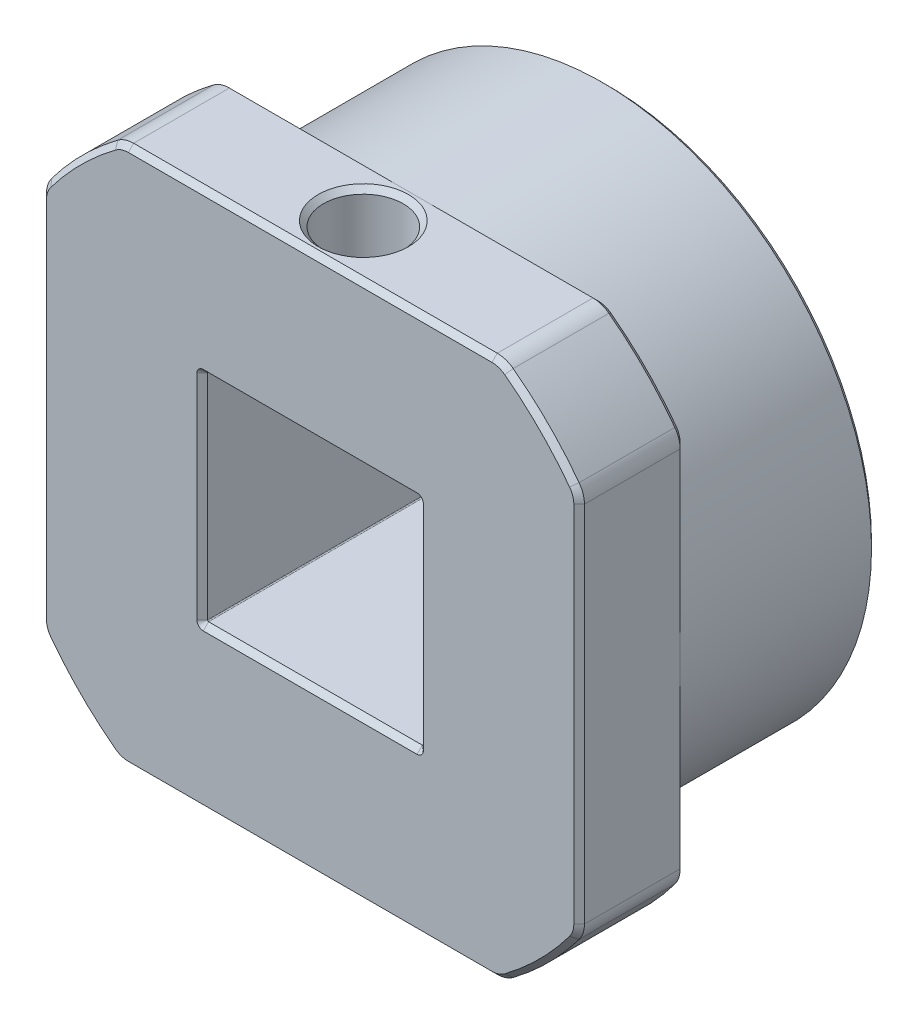
from build123d import *

# Parameters (mm, degrees)
SKIZZE1_R                       = 25.3
SKIZZE1_W                       = 20.3
SKIZZE1_H                       = 20.3
AUFSATZ_LINEAR_AUSTRAGEN1_DEPTH = 18
SKIZZE2_W                       = 20.3
SKIZZE2_H                       = 20.3
AUFSATZ_LINEAR_AUSTRAGEN2_DEPTH = 10
SCHNITT_LINEAR_AUSTRAGEN1_REACH = 65.122
SKIZZE3_R                       = 2.3
CUT_EXTRUDE2_START              = -50.6
SKETCH1_2_R                     = 3.75
CUT_EXTRUDE2_DEPTH              = 7.95
VERRUNDUNG1_R                   = 0.1
VERRUNDUNG2_R                   = 2.5
FASE1_SIZE                      = 0.5


with BuildPart() as part:
    # Skizze1 → Aufsatz-Linear austragen1 (new body)
    with BuildSketch(Plane.XY):
        Circle(SKIZZE1_R)
        Rectangle(SKIZZE1_W, SKIZZE1_H, mode=Mode.SUBTRACT)
    extrude(amount=AUFSATZ_LINEAR_AUSTRAGEN1_DEPTH)

    # Skizze2 → Aufsatz-Linear austragen2 (add)
    with BuildSketch(Plane.XY.offset(18)):
        with BuildLine():
            Line((-17.913961036, 25.3), (17.913961036, 25.3))
            ThreePointArc((17.913961036, 25.3), (21.920310217, 21.920310217), (25.3, 17.913961036))
            Line((25.3, 17.913961036), (25.3, -17.913961036))
            ThreePointArc((25.3, -17.913961036), (21.920310217, -21.920310217), (17.913961036, -25.3))
            Line((17.913961036, -25.3), (-17.913961036, -25.3))
            ThreePointArc((-17.913961036, -25.3), (-21.920310217, -21.920310217), (-25.3, -17.913961036))
            Line((-25.3, -17.913961036), (-25.3, 17.913961036))
            ThreePointArc((-25.3, 17.913961036), (-21.920310217, 21.920310217), (-17.913961036, 25.3))
        make_face()
        Rectangle(SKIZZE2_W, SKIZZE2_H, mode=Mode.SUBTRACT)
    extrude(amount=AUFSATZ_LINEAR_AUSTRAGEN2_DEPTH)

    # Skizze3 → Schnitt-Linear austragen1 (cut, up to next)
    with BuildSketch(Plane(origin=(0, 25.3, 0), x_dir=(1, 0, 0), z_dir=(0, 1, 0)), mode=Mode.PRIVATE) as schnitt_linear_austragen1_sk1:
        with Locations(Location((0, -23, 0), (0, 0, 270))):
            Circle(SKIZZE3_R)
    schnitt_linear_austragen1_tool1 = extrude(schnitt_linear_austragen1_sk1.sketch, amount=-SCHNITT_LINEAR_AUSTRAGEN1_REACH, mode=Mode.PRIVATE) & part.part
    add(schnitt_linear_austragen1_tool1.solids().sort_by_distance((0, 25.3, 23))[0], mode=Mode.SUBTRACT)

    # Sketch1<2> → Cut-Extrude2 (cut)
    with BuildSketch(Plane.XZ.offset(25.3).offset(CUT_EXTRUDE2_START)):
        with Locations(Location((0, 23, 0), (0, 0, 270))):
            Circle(SKETCH1_2_R)
    extrude(amount=CUT_EXTRUDE2_DEPTH, mode=Mode.SUBTRACT)

    # Verrundung1
    verrundung1_edges = [part.edges().sort_by_distance(p)[0] for p in [
        (10.15, -10.15, 14),
        (10.15, 10.15, 14),
        (-10.15, 10.15, 14),
        (-10.15, -10.15, 14),
    ]]
    fillet(verrundung1_edges, radius=VERRUNDUNG1_R)

    # Verrundung2
    verrundung2_edges = [part.edges().sort_by_distance(p)[0] for p in [
        (-17.913961036, 25.3, 23),
        (-25.3, 17.913961036, 23),
        (-25.3, -17.913961036, 23),
        (-17.913961036, -25.3, 23),
        (17.913961036, -25.3, 23),
        (25.3, -17.913961036, 23),
        (25.3, 17.913961036, 23),
        (17.913961036, 25.3, 23),
    ]]
    fillet(verrundung2_edges, radius=VERRUNDUNG2_R)

    # Fase1
    # the kernel refuses this chamfer: 0.5 mm, written as the material it takes off along each edge
    with BuildSketch(Plane(origin=(-22.8, -17.1, 18), x_dir=(-0.8000000000000012, -0.5999999999999983, 0), z_dir=(0.5999999999999983, -0.8000000000000012, 0))) as fase1_piece_1:
        Polygon((2.5, -FASE1_SIZE), (2.5 - FASE1_SIZE, 0), (2.5, 0), align=None)
    revolve(axis=Axis((-22.8, -17.1, 18), (0, 0, -1)), revolution_arc=36.869897646, mode=Mode.SUBTRACT)
    with BuildSketch(Plane(origin=(-25.3, 8.3e-08, 18), x_dir=(-0.027495876610589005, 0, 0.9996219169112968), z_dir=(0, 1, 0))) as fase1_piece_2_section:
        Polygon((FASE1_SIZE * 0.999621916911, FASE1_SIZE * 0.0274958766106), (-FASE1_SIZE * 0.0274958766106, FASE1_SIZE * 0.999621916911), (0, 0), align=None)
    fase1_piece_2 = extrude(amount=17.099999917, mode=Mode.PRIVATE)
    fase1_piece_2 = fase1_piece_2 - Plane(origin=(0, 0, 18.17274178), x_dir=(1, 0, 0), z_dir=(0, 0, -1)) * Cylinder(25.3, 37, mode=Mode.PRIVATE)
    add(fase1_piece_2, mode=Mode.SUBTRACT)
    with BuildSketch(Plane(origin=(-25.3, -17.1, 28), x_dir=(0.9996219169112968, 0, 0.027495876610589005), z_dir=(0, 1, 0)), Plane(origin=(17.1, -25.3, 28), x_dir=(0, 0.9996219169112968, 0.027495876610589005), z_dir=(-1, 0, 0)), Plane(origin=(25.3, 17.1, 28), x_dir=(-0.9996219169112968, 0, 0.027495876610589005), z_dir=(0, -1, 0)), Plane(origin=(-17.1, 25.3, 28), x_dir=(0, -0.9996219169112968, 0.027495876610589005), z_dir=(1, 0, 0))) as fase1_piece_3:
        Polygon((FASE1_SIZE * 0.999621916911, FASE1_SIZE * 0.0274958766106), (-FASE1_SIZE * 0.0274958766106, FASE1_SIZE * 0.999621916911), (0, 0), align=None)
    extrude(amount=34.2, mode=Mode.SUBTRACT)
    with BuildSketch(Plane(origin=(0, 0, 28), x_dir=(-0.8000000000000004, 0.5999999999999995, 0), z_dir=(-0.5999999999999995, -0.8000000000000004, 0))) as fase1_piece_4:
        Polygon((31 - FASE1_SIZE, 0), (31, FASE1_SIZE), (31, 0), align=None)
    revolve(axis=Axis((0, 0, 28), (0, 0, -1)), revolution_arc=16.260204708, mode=Mode.SUBTRACT)
    with BuildSketch(Plane(origin=(0, 0, 28), x_dir=(0.8, -0.5999999999999999, 0), z_dir=(0.5999999999999999, 0.8, 0))) as fase1_piece_5:
        Polygon((31 - FASE1_SIZE, 0), (31, FASE1_SIZE), (31, 0), align=None)
    revolve(axis=Axis((0, 0, 28), (0, 0, -1)), revolution_arc=16.260204708, mode=Mode.SUBTRACT)
    with BuildSketch(Plane(origin=(0, 0, 28), x_dir=(0.5999999999999996, 0.8000000000000003, 0), z_dir=(-0.8000000000000003, 0.5999999999999996, 0))) as fase1_piece_6:
        Polygon((31 - FASE1_SIZE, 0), (31, FASE1_SIZE), (31, 0), align=None)
    revolve(axis=Axis((0, 0, 28), (0, 0, -1)), revolution_arc=16.260204708, mode=Mode.SUBTRACT)
    with BuildSketch(Plane(origin=(-17.1, 22.8, 28), x_dir=(0, 1, 0), z_dir=(1, 0, 0))) as fase1_piece_7:
        Polygon((2.5 - FASE1_SIZE, 0), (2.5, -FASE1_SIZE), (2.5, 0), align=None)
    revolve(axis=Axis((-17.1, 22.8, 28), (0, 0, 1)), revolution_arc=36.869897646, mode=Mode.SUBTRACT)
    with BuildSketch(Plane(origin=(-22.8, 17.1, 28), x_dir=(-1, 0, 0), z_dir=(0, -1, 0))) as fase1_piece_8:
        Polygon((2.5 - FASE1_SIZE, 0), (2.5, FASE1_SIZE), (2.5, 0), align=None)
    revolve(axis=Axis((-22.8, 17.1, 28), (0, 0, -1)), revolution_arc=36.869897646, mode=Mode.SUBTRACT)
    with BuildSketch(Plane(origin=(17.1, 22.8, 28), x_dir=(0, 1, 0), z_dir=(-1, 0, 0))) as fase1_piece_9:
        Polygon((2.5 - FASE1_SIZE, 0), (2.5, FASE1_SIZE), (2.5, 0), align=None)
    revolve(axis=Axis((17.1, 22.8, 28), (0, 0, -1)), revolution_arc=36.869897646, mode=Mode.SUBTRACT)
    with BuildSketch(Plane(origin=(22.8, 17.1, 28), x_dir=(0.8, 0.6, 0), z_dir=(-0.6, 0.8, 0))) as fase1_piece_10:
        Polygon((2.5 - FASE1_SIZE, 0), (2.5, FASE1_SIZE), (2.5, 0), align=None)
    revolve(axis=Axis((22.8, 17.1, 28), (0, 0, -1)), revolution_arc=36.869897646, mode=Mode.SUBTRACT)
    with BuildSketch(Plane(origin=(22.8, -17.1, 28), x_dir=(1, 0, 0), z_dir=(0, 1, 0))) as fase1_piece_11:
        Polygon((2.5 - FASE1_SIZE, 0), (2.5, FASE1_SIZE), (2.5, 0), align=None)
    revolve(axis=Axis((22.8, -17.1, 28), (0, 0, -1)), revolution_arc=36.869897646, mode=Mode.SUBTRACT)
    with BuildSketch(Plane(origin=(17.1, -22.8, 28), x_dir=(0.6000000000000009, -0.7999999999999993, 0), z_dir=(0.7999999999999993, 0.6000000000000009, 0))) as fase1_piece_12:
        Polygon((2.5 - FASE1_SIZE, 0), (2.5, FASE1_SIZE), (2.5, 0), align=None)
    revolve(axis=Axis((17.1, -22.8, 28), (0, 0, -1)), revolution_arc=36.869897646, mode=Mode.SUBTRACT)
    with BuildSketch(Plane(origin=(-17.1, -22.8, 28), x_dir=(0, -1, 0), z_dir=(1, 0, 0))) as fase1_piece_13:
        Polygon((2.5 - FASE1_SIZE, 0), (2.5, FASE1_SIZE), (2.5, 0), align=None)
    revolve(axis=Axis((-17.1, -22.8, 28), (0, 0, -1)), revolution_arc=36.869897646, mode=Mode.SUBTRACT)
    with BuildSketch(Plane(origin=(-22.8, -17.1, 28), x_dir=(-0.8000000000000012, -0.5999999999999983, 0), z_dir=(0.5999999999999983, -0.8000000000000012, 0))) as fase1_piece_14:
        Polygon((2.5 - FASE1_SIZE, 0), (2.5, FASE1_SIZE), (2.5, 0), align=None)
    revolve(axis=Axis((-22.8, -17.1, 28), (0, 0, -1)), revolution_arc=36.869897646, mode=Mode.SUBTRACT)
    with BuildSketch(Plane(origin=(0, 0, 18), x_dir=(0.8, -0.5999999999999999, 0), z_dir=(0.5999999999999999, 0.8, 0))) as fase1_piece_15:
        Polygon((31, -FASE1_SIZE), (31 - FASE1_SIZE, 0), (31, 0), align=None)
    revolve(axis=Axis((0, 0, 18), (0, 0, -1)), revolution_arc=16.260204708, mode=Mode.SUBTRACT)
    with BuildSketch(Plane(origin=(25.3, 0, 18), x_dir=(0.027495876610589005, 0, 0.9996219169112968), z_dir=(0, -1, 0))) as fase1_piece_16_section:
        Polygon((FASE1_SIZE * 0.999621916911, FASE1_SIZE * 0.0274958766106), (-FASE1_SIZE * 0.0274958766106, FASE1_SIZE * 0.999621916911), (0, 0), align=None)
    fase1_piece_16 = extrude(amount=17.1, mode=Mode.PRIVATE)
    fase1_piece_16 = fase1_piece_16 - Plane(origin=(0, 0, 18.172741783), x_dir=(1, 0, 0), z_dir=(0, 0, -1)) * Cylinder(25.3, 37, mode=Mode.PRIVATE)
    add(fase1_piece_16, mode=Mode.SUBTRACT)
    with BuildSketch(Plane(origin=(22.8, -17.1, 18), x_dir=(1, 0, 0), z_dir=(0, 1, 0))) as fase1_piece_17:
        Polygon((2.5, -FASE1_SIZE), (2.5 - FASE1_SIZE, 0), (2.5, 0), align=None)
    revolve(axis=Axis((22.8, -17.1, 18), (0, 0, -1)), revolution_arc=36.869897646, mode=Mode.SUBTRACT)
    with BuildSketch(Plane(origin=(17.1, -22.8, 18), x_dir=(0.6000000000000009, -0.7999999999999993, 0), z_dir=(0.7999999999999993, 0.6000000000000009, 0))) as fase1_piece_18:
        Polygon((2.5, -FASE1_SIZE), (2.5 - FASE1_SIZE, 0), (2.5, 0), align=None)
    revolve(axis=Axis((17.1, -22.8, 18), (0, 0, -1)), revolution_arc=36.869897646, mode=Mode.SUBTRACT)
    with BuildSketch(Plane(origin=(0, 0, 18), x_dir=(0.5999999999999996, 0.8000000000000003, 0), z_dir=(-0.8000000000000003, 0.5999999999999996, 0))) as fase1_piece_19:
        Polygon((31, -FASE1_SIZE), (31 - FASE1_SIZE, 0), (31, 0), align=None)
    revolve(axis=Axis((0, 0, 18), (0, 0, -1)), revolution_arc=16.260204708, mode=Mode.SUBTRACT)
    with BuildSketch(Plane(origin=(0, 25.3, 18), x_dir=(0, 0.027495876610589005, 0.9996219169112968), z_dir=(1, 0, 0))) as fase1_piece_20_section:
        Polygon((FASE1_SIZE * 0.999621916911, FASE1_SIZE * 0.0274958766106), (-FASE1_SIZE * 0.0274958766106, FASE1_SIZE * 0.999621916911), (0, 0), align=None)
    fase1_piece_20 = extrude(amount=17.1, mode=Mode.PRIVATE)
    fase1_piece_20 = fase1_piece_20 - Plane(origin=(0, 0, 18.17274178), x_dir=(1, 0, 0), z_dir=(0, 0, -1)) * Cylinder(25.3, 37, mode=Mode.PRIVATE)
    add(fase1_piece_20, mode=Mode.SUBTRACT)
    with BuildSketch(Plane(origin=(17.1, 22.8, 18), x_dir=(0, 1, 0), z_dir=(-1, 0, 0))) as fase1_piece_21:
        Polygon((2.5, -FASE1_SIZE), (2.5 - FASE1_SIZE, 0), (2.5, 0), align=None)
    revolve(axis=Axis((17.1, 22.8, 18), (0, 0, -1)), revolution_arc=36.869897646, mode=Mode.SUBTRACT)
    with BuildSketch(Plane(origin=(22.8, 17.1, 18), x_dir=(0.8, 0.6, 0), z_dir=(-0.6, 0.8, 0))) as fase1_piece_22:
        Polygon((2.5, -FASE1_SIZE), (2.5 - FASE1_SIZE, 0), (2.5, 0), align=None)
    revolve(axis=Axis((22.8, 17.1, 18), (0, 0, -1)), revolution_arc=36.869897646, mode=Mode.SUBTRACT)
    with BuildSketch(Plane(origin=(0, 0, 18), x_dir=(-0.8000000000000004, 0.5999999999999995, 0), z_dir=(-0.5999999999999995, -0.8000000000000004, 0))) as fase1_piece_23:
        Polygon((31, -FASE1_SIZE), (31 - FASE1_SIZE, 0), (31, 0), align=None)
    revolve(axis=Axis((0, 0, 18), (0, 0, -1)), revolution_arc=16.260204708, mode=Mode.SUBTRACT)
    with BuildSketch(Plane(origin=(-17.1, 22.8, 18), x_dir=(0, 1, 0), z_dir=(1, 0, 0))) as fase1_piece_24:
        Polygon((2.5, FASE1_SIZE), (2.5 - FASE1_SIZE, 0), (2.5, 0), align=None)
    revolve(axis=Axis((-17.1, 22.8, 18), (0, 0, 1)), revolution_arc=36.869897646, mode=Mode.SUBTRACT)
    with BuildSketch(Plane(origin=(-22.8, 17.1, 18), x_dir=(-1, 0, 0), z_dir=(0, -1, 0))) as fase1_piece_25:
        Polygon((2.5, -FASE1_SIZE), (2.5 - FASE1_SIZE, 0), (2.5, 0), align=None)
    revolve(axis=Axis((-22.8, 17.1, 18), (0, 0, -1)), revolution_arc=36.869897646, mode=Mode.SUBTRACT)
    with BuildSketch(Plane(origin=(0, 0, 0), x_dir=(1, 0, 0), z_dir=(0, -1, 0))) as fase1_piece_26:
        Polygon((25.3 - FASE1_SIZE, 0), (25.3, FASE1_SIZE), (25.3, 0), align=None)
    revolve(axis=Axis((0, 0, 0), (0, 0, 1)), mode=Mode.SUBTRACT)
    with BuildSketch(Plane(origin=(-25.3, -17.1, 18), x_dir=(-0.027495876610589005, 0, 0.9996219169112968), z_dir=(0, 1, 0))) as fase1_piece_27_section:
        Polygon((FASE1_SIZE * 0.999621916911, FASE1_SIZE * 0.0274958766106), (-FASE1_SIZE * 0.0274958766106, FASE1_SIZE * 0.999621916911), (0, 0), align=None)
    fase1_piece_27 = extrude(amount=17.100000083, mode=Mode.PRIVATE)
    fase1_piece_27 = fase1_piece_27 - Plane(origin=(0, 0, 18.17274177), x_dir=(1, 0, 0), z_dir=(0, 0, -1)) * Cylinder(25.3, 37, mode=Mode.PRIVATE)
    add(fase1_piece_27, mode=Mode.SUBTRACT)
    with BuildSketch(Plane(origin=(17.1, -25.3, 18), x_dir=(0, -0.027495876610589005, 0.9996219169112968), z_dir=(-1, 0, 0))) as fase1_piece_28_section:
        Polygon((FASE1_SIZE * 0.999621916911, FASE1_SIZE * 0.0274958766106), (-FASE1_SIZE * 0.0274958766106, FASE1_SIZE * 0.999621916911), (0, 0), align=None)
    fase1_piece_28 = extrude(amount=17.099999919, mode=Mode.PRIVATE)
    fase1_piece_28 = fase1_piece_28 - Plane(origin=(0, 0, 18.17274177), x_dir=(1, 0, 0), z_dir=(0, 0, -1)) * Cylinder(25.3, 37, mode=Mode.PRIVATE)
    add(fase1_piece_28, mode=Mode.SUBTRACT)
    with BuildSketch(Plane(origin=(25.3, 17.1, 18), x_dir=(0.027495876610589005, 0, 0.9996219169112968), z_dir=(0, -1, 0))) as fase1_piece_29_section:
        Polygon((FASE1_SIZE * 0.999621916911, FASE1_SIZE * 0.0274958766106), (-FASE1_SIZE * 0.0274958766106, FASE1_SIZE * 0.999621916911), (0, 0), align=None)
    fase1_piece_29 = extrude(amount=17.1, mode=Mode.PRIVATE)
    fase1_piece_29 = fase1_piece_29 - Plane(origin=(0, 0, 18.17274177), x_dir=(1, 0, 0), z_dir=(0, 0, -1)) * Cylinder(25.3, 37, mode=Mode.PRIVATE)
    add(fase1_piece_29, mode=Mode.SUBTRACT)
    with BuildSketch(Plane(origin=(-17.1, 25.3, 18), x_dir=(0, 0.027495876610589005, 0.9996219169112968), z_dir=(1, 0, 0))) as fase1_piece_30_section:
        Polygon((FASE1_SIZE * 0.999621916911, FASE1_SIZE * 0.0274958766106), (-FASE1_SIZE * 0.0274958766106, FASE1_SIZE * 0.999621916911), (0, 0), align=None)
    fase1_piece_30 = extrude(amount=17.1, mode=Mode.PRIVATE)
    fase1_piece_30 = fase1_piece_30 - Plane(origin=(0, 0, 18.172741783), x_dir=(1, 0, 0), z_dir=(0, 0, -1)) * Cylinder(25.3, 37, mode=Mode.PRIVATE)
    add(fase1_piece_30, mode=Mode.SUBTRACT)
    with BuildSketch(Plane(origin=(0, 10.15, 23), x_dir=(0, 0, 1), z_dir=(-1, 0, 0))) as fase1_piece_31:
        Polygon((2.3 + FASE1_SIZE, 0), (2.3, FASE1_SIZE), (2.3, 0), align=None)
    revolve(axis=Axis((0, 10.15, 23), (0, 1, 0)), mode=Mode.SUBTRACT)
    with BuildSketch(Plane(origin=(0, 25.3, 23), x_dir=(0, 0, -1), z_dir=(-1, 0, 0))) as fase1_piece_32:
        Polygon((3.75 + FASE1_SIZE, 0), (3.75, FASE1_SIZE), (3.75, 0), align=None)
    revolve(axis=Axis((0, 25.3, 23), (0, -1, 0)), mode=Mode.SUBTRACT)
    with BuildSketch(Plane(origin=(-10.05, -10.15, 0), x_dir=(0, 0.02749587661058563, 0.9996219169112968), z_dir=(1, 0, 0)), Plane(origin=(-10.05, -10.15, 28), x_dir=(0, -0.9996219169112968, 0.0274958766105891), z_dir=(1, 0, 0)), Plane(origin=(10.15, -10.05, 0), x_dir=(-0.02749587661058563, 0, 0.9996219169112968), z_dir=(0, 1, 0)), Plane(origin=(10.15, -10.05, 28), x_dir=(0.9996219169112968, 0, 0.0274958766105891), z_dir=(0, 1, 0)), Plane(origin=(-10.15, 10.05, 0), x_dir=(0.02749587661058563, 0, 0.9996219169112968), z_dir=(0, -1, 0)), Plane(origin=(-10.15, 10.05, 28), x_dir=(-0.9996219169112968, 0, 0.0274958766105891), z_dir=(0, -1, 0)), Plane(origin=(10.05, 10.15, 0), x_dir=(0, -0.02749587661058563, 0.9996219169112968), z_dir=(-1, 0, 0)), Plane(origin=(10.05, 10.15, 28), x_dir=(0, 0.9996219169112968, 0.0274958766105891), z_dir=(-1, 0, 0))) as fase1_piece_33:
        Polygon((FASE1_SIZE * 0.999621916911, FASE1_SIZE * 0.0274958766106), (-FASE1_SIZE * 0.0274958766106, FASE1_SIZE * 0.999621916911), (0, 0), align=None)
    extrude(amount=20.1, mode=Mode.SUBTRACT)
    with BuildSketch(Plane(origin=(10.05, -10.05, 0), x_dir=(1, 0, 0), z_dir=(0, 1, 0))) as fase1_piece_34:
        Polygon((0.1, -FASE1_SIZE), (0.1 + FASE1_SIZE, 0), (0.1, 0), align=None)
    revolve(axis=Axis((10.05, -10.05, 0), (0, 0, -1)), revolution_arc=90, mode=Mode.SUBTRACT)
    with BuildSketch(Plane(origin=(10.05, -10.05, 28), x_dir=(1, 0, 0), z_dir=(0, 1, 0))) as fase1_piece_35:
        Polygon((0.1 + FASE1_SIZE, 0), (0.1, FASE1_SIZE), (0.1, 0), align=None)
    revolve(axis=Axis((10.05, -10.05, 28), (0, 0, -1)), revolution_arc=90, mode=Mode.SUBTRACT)
    with BuildSketch(Plane(origin=(-10.05, -10.05, 0), x_dir=(-1, 0, 0), z_dir=(0, 1, 0))) as fase1_piece_36:
        Polygon((0.1, FASE1_SIZE), (0.1 + FASE1_SIZE, 0), (0.1, 0), align=None)
    revolve(axis=Axis((-10.05, -10.05, 0), (0, 0, 1)), revolution_arc=90, mode=Mode.SUBTRACT)
    with BuildSketch(Plane(origin=(-10.05, -10.05, 28), x_dir=(-1, 0, 0), z_dir=(0, 1, 0))) as fase1_piece_37:
        Polygon((0.1 + FASE1_SIZE, 0), (0.1, -FASE1_SIZE), (0.1, 0), align=None)
    revolve(axis=Axis((-10.05, -10.05, 28), (0, 0, 1)), revolution_arc=90, mode=Mode.SUBTRACT)
    with BuildSketch(Plane(origin=(-10.05, 10.05, 0), x_dir=(-1, 0, 0), z_dir=(0, -1, 0))) as fase1_piece_38:
        Polygon((0.1, -FASE1_SIZE), (0.1 + FASE1_SIZE, 0), (0.1, 0), align=None)
    revolve(axis=Axis((-10.05, 10.05, 0), (0, 0, -1)), revolution_arc=90, mode=Mode.SUBTRACT)
    with BuildSketch(Plane(origin=(-10.05, 10.05, 28), x_dir=(-1, 0, 0), z_dir=(0, -1, 0))) as fase1_piece_39:
        Polygon((0.1 + FASE1_SIZE, 0), (0.1, FASE1_SIZE), (0.1, 0), align=None)
    revolve(axis=Axis((-10.05, 10.05, 28), (0, 0, -1)), revolution_arc=90, mode=Mode.SUBTRACT)
    with BuildSketch(Plane(origin=(10.05, 10.05, 0), x_dir=(0, 1, 0), z_dir=(-1, 0, 0))) as fase1_piece_40:
        Polygon((0.1, -FASE1_SIZE), (0.1 + FASE1_SIZE, 0), (0.1, 0), align=None)
    revolve(axis=Axis((10.05, 10.05, 0), (0, 0, -1)), revolution_arc=90, mode=Mode.SUBTRACT)
    with BuildSketch(Plane(origin=(10.05, 10.05, 28), x_dir=(0, 1, 0), z_dir=(-1, 0, 0))) as fase1_piece_41:
        Polygon((0.1 + FASE1_SIZE, 0), (0.1, FASE1_SIZE), (0.1, 0), align=None)
    revolve(axis=Axis((10.05, 10.05, 28), (0, 0, -1)), revolution_arc=90, mode=Mode.SUBTRACT)
    with BuildSketch(Plane(origin=(0, 0, 18), x_dir=(-0.5999999999999953, -0.8000000000000035, 0), z_dir=(0.8000000000000035, -0.5999999999999953, 0))) as fase1_piece_42:
        Polygon((31, -FASE1_SIZE), (31 - FASE1_SIZE, 0), (31, 0), align=None)
    revolve(axis=Axis((0, 0, 18), (0, 0, -1)), revolution_arc=16.260204708, mode=Mode.SUBTRACT)
    with BuildSketch(Plane(origin=(0, 0, 28), x_dir=(-0.5999999999999953, -0.8000000000000035, 0), z_dir=(0.8000000000000035, -0.5999999999999953, 0))) as fase1_piece_43:
        Polygon((31 - FASE1_SIZE, 0), (31, FASE1_SIZE), (31, 0), align=None)
    revolve(axis=Axis((0, 0, 28), (0, 0, -1)), revolution_arc=16.260204708, mode=Mode.SUBTRACT)
    with BuildSketch(Plane(origin=(8.1e-08, -25.3, 18), x_dir=(0, -0.027495876610589005, 0.9996219169112968), z_dir=(-1, 0, 0))) as fase1_piece_44_section:
        Polygon((FASE1_SIZE * 0.999621916911, FASE1_SIZE * 0.0274958766106), (-FASE1_SIZE * 0.0274958766106, FASE1_SIZE * 0.999621916911), (0, 0), align=None)
    fase1_piece_44 = extrude(amount=17.100000081, mode=Mode.PRIVATE)
    fase1_piece_44 = fase1_piece_44 - Plane(origin=(0, 0, 18.17274178), x_dir=(1, 0, 0), z_dir=(0, 0, -1)) * Cylinder(25.3, 37, mode=Mode.PRIVATE)
    add(fase1_piece_44, mode=Mode.SUBTRACT)
    with BuildSketch(Plane(origin=(-17.1, -22.8, 18), x_dir=(0, -1, 0), z_dir=(1, 0, 0))) as fase1_piece_45:
        Polygon((2.5, -FASE1_SIZE), (2.5 - FASE1_SIZE, 0), (2.5, 0), align=None)
    revolve(axis=Axis((-17.1, -22.8, 18), (0, 0, -1)), revolution_arc=36.869897646, mode=Mode.SUBTRACT)


solid = part.part
